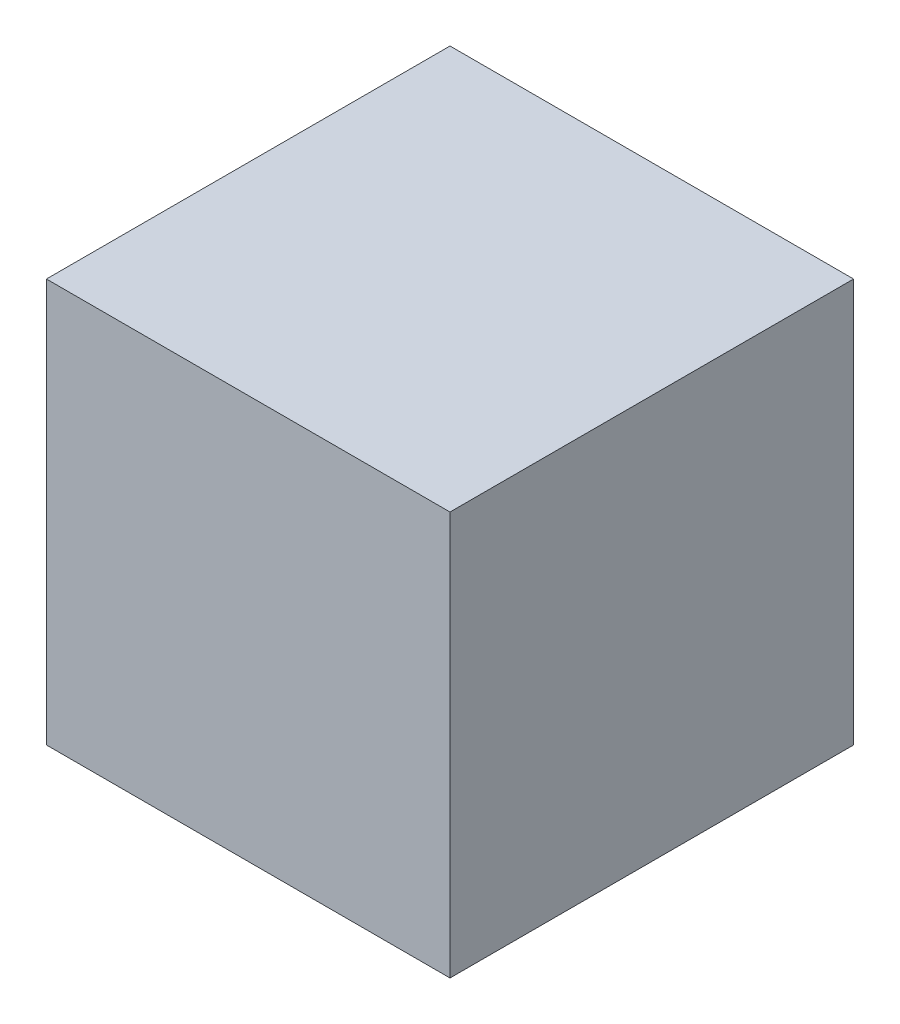
from build123d import *

# Parameters (mm, degrees)
SKETCH5_W           = 1000
SKETCH5_H           = 1000
BOSS_EXTRUDE2_DEPTH = 1000
SKETCH7_R           = 250
CUT_EXTRUDE2_DEPTH  = 400


with BuildPart() as part:
    # Sketch5 → Boss-Extrude2 (new body)
    with BuildSketch(Plane(origin=(0, 0, 0), x_dir=(0, 0, -1), z_dir=(1, 0, 0))):
        with Locations((500, 500)):
            Rectangle(SKETCH5_W, SKETCH5_H)
    extrude(amount=BOSS_EXTRUDE2_DEPTH)

    # Sketch6 → Cut-Revolve5 (revolve, cut)
    with BuildSketch(Plane(origin=(500, 0, 0), x_dir=(0, 0, -1), z_dir=(1, 0, 0))):
        with BuildLine():
            Line((83.20002133, 500), (916.79997867, 500))
            ThreePointArc((916.79997867, 500), (500, 916.79997867), (83.20002133, 500))
        make_face()
    revolve(axis=Axis((500, 500, -83.20002133), (0, 0, -1)), mode=Mode.SUBTRACT)

    # Sketch7 → Cut-Extrude2 (cut)
    with BuildSketch(Plane(origin=(0, 0, 0), x_dir=(0, 0, -1), z_dir=(1, 0, 0))):
        with Locations((500, 500)):
            Circle(SKETCH7_R)
    extrude(amount=CUT_EXTRUDE2_DEPTH, mode=Mode.SUBTRACT)


solid = part.part
